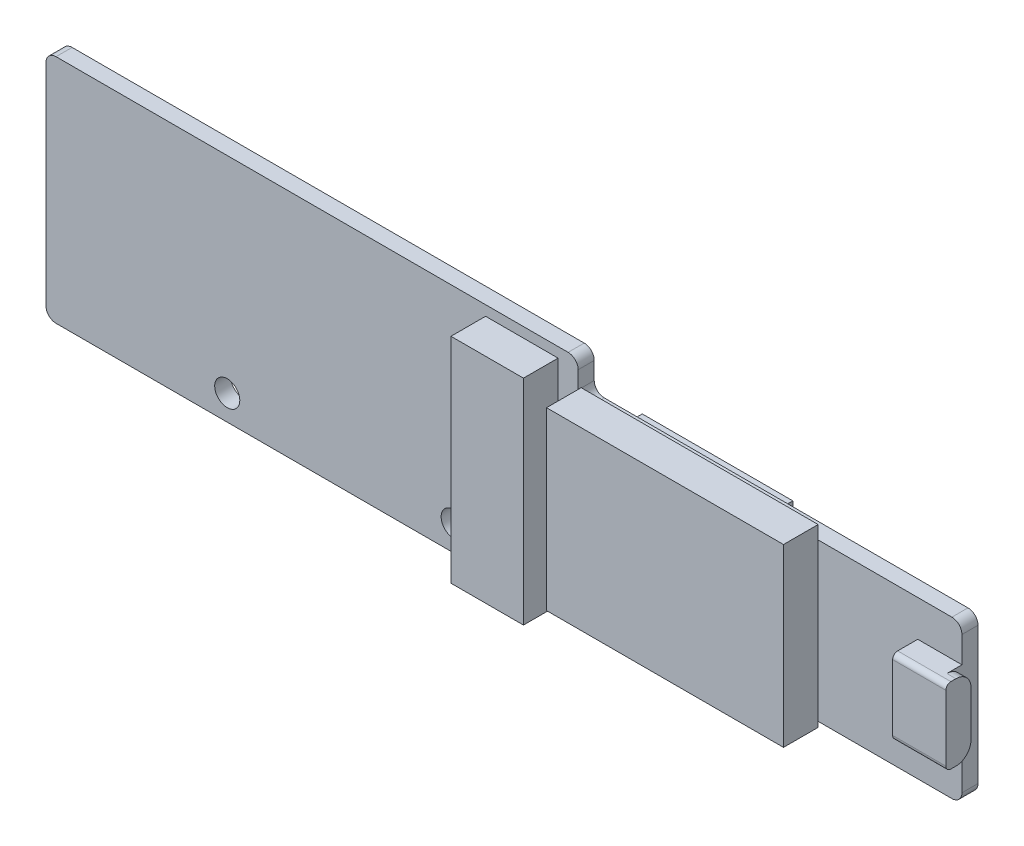
from build123d import *

# Parameters (mm, degrees)
SKETCH1_R           = 1.25
BOSS_EXTRUDE2_DEPTH = 1.6
SKETCH2_W           = 15
SKETCH2_H           = 15.35
BOSS_EXTRUDE3_DEPTH = 0.66
SKETCH3_W           = 5.3
SKETCH3_H           = 7.54
BOSS_EXTRUDE4_DEPTH = 2.5
FILLET1_R           = 0.5
FILLET2_R           = 1.5
SKETCH4_W           = 5.3
SKETCH4_H           = 7.54
BOSS_EXTRUDE5_DEPTH = 2.5
FILLET3_R           = 0.5
FILLET4_R           = 1.5
SKETCH5_W           = 7.22
SKETCH5_H           = 21.3
SKETCH5_W_2         = 23.6
SKETCH5_H_2         = 17.5
BOSS_EXTRUDE6_DEPTH = 3.45
FILLET5_R           = 1


with BuildPart() as part:
    # Sketch1 → Boss-Extrude2 (new body)
    with BuildSketch(Plane.XY):
        Polygon((0, 0), (53, 0), (53, 3.62), (91.22, 3.62), (91.22, 19.27), (53, 19.27), (53, 23), (0, 23), align=None)
        with Locations((40.6, 2.5)):
            Circle(SKETCH1_R, mode=Mode.SUBTRACT)
        with Locations((18.05, 2.5)):
            Circle(SKETCH1_R, mode=Mode.SUBTRACT)
    extrude(amount=BOSS_EXTRUDE2_DEPTH)

    # Sketch2 → Boss-Extrude3 (add)
    with BuildSketch(Plane(origin=(0, 0, 0), x_dir=(-1, 0, 0), z_dir=(0, 0, -1))):
        with Locations((-64.62, 11.445)):
            Rectangle(SKETCH2_W, SKETCH2_H)
    extrude(amount=BOSS_EXTRUDE3_DEPTH)

    # Sketch3 → Boss-Extrude4 (add)
    with BuildSketch(Plane.XY.offset(1.6)):
        with Locations((89.47, 11.89)):
            Rectangle(SKETCH3_W, SKETCH3_H)
    extrude(amount=BOSS_EXTRUDE4_DEPTH)

    # Fillet1
    fillet1_edges = [part.edges().sort_by_distance(p)[0] for p in [
        (89.47, 15.66, 4.1),
        (89.47, 8.12, 4.1),
    ]]
    fillet(fillet1_edges, radius=FILLET1_R)

    # Fillet2
    fillet2_edges = [part.edges().sort_by_distance(p)[0] for p in [
        (91.67, 15.66, 1.6),
        (91.67, 8.12, 1.6),
    ]]
    fillet(fillet2_edges, radius=FILLET2_R)

    # Sketch4 → Boss-Extrude5 (add)
    with BuildSketch(Plane(origin=(0, 0, 0), x_dir=(-1, 0, 0), z_dir=(0, 0, -1))):
        with Locations((-1.75, 11.47)):
            Rectangle(SKETCH4_W, SKETCH4_H)
    extrude(amount=BOSS_EXTRUDE5_DEPTH)

    # Fillet3
    fillet3_edges = [part.edges().sort_by_distance(p)[0] for p in [
        (1.75, 15.24, -2.5),
        (1.75, 7.7, -2.5),
    ]]
    fillet(fillet3_edges, radius=FILLET3_R)

    # Fillet4
    fillet4_edges = [part.edges().sort_by_distance(p)[0] for p in [
        (-0.45, 15.24, 0),
        (-0.45, 7.7, 0),
    ]]
    fillet(fillet4_edges, radius=FILLET4_R)

    # Sketch5 → Boss-Extrude6 (add)
    with BuildSketch(Plane.XY.offset(1.6)):
        with Locations((47.39, 11.35)):
            Rectangle(SKETCH5_W, SKETCH5_H)
        with Locations((65.1, 11.85)):
            Rectangle(SKETCH5_W_2, SKETCH5_H_2)
    extrude(amount=BOSS_EXTRUDE6_DEPTH)

    # Fillet5
    # the kernel refuses this fillet: 1 mm, written as the material it adds along each edge
    with BuildSketch(Plane(origin=(53, 19.27, 0), x_dir=(0, 1, 0), z_dir=(0, 0, 1)), Plane(origin=(53, 3.62, 0), x_dir=(1, 0, 0), z_dir=(0, 0, 1))) as fillet5_piece_1:
        with BuildLine():
            CenterArc((FILLET5_R, -FILLET5_R), FILLET5_R, 90, 90)
            Line((0, -FILLET5_R), (0, 0))
            Line((0, 0), (FILLET5_R, 0))
        make_face()
    extrude(amount=1.6)
    # the kernel refuses this fillet: 1 mm, written as the material it takes off along each edge
    with BuildSketch(Plane(origin=(0, 23, -2.5), x_dir=(1, 0, 0), z_dir=(0, 0, 1))) as fillet5_2_piece_1:
        with BuildLine():
            CenterArc((FILLET5_R, -FILLET5_R), FILLET5_R, 90, 90)
            Line((0, -FILLET5_R), (0, 0))
            Line((0, 0), (FILLET5_R, 0))
        make_face()
    extrude(amount=6.6, mode=Mode.SUBTRACT)
    with BuildSketch(Plane(origin=(53, 23, -2.5), x_dir=(-1, 0, 0), z_dir=(0, 0, 1)), Plane(origin=(91.22, 19.27, -2.5), x_dir=(-1, 0, 0), z_dir=(0, 0, 1)), Plane(origin=(91.22, 3.62, -2.5), x_dir=(0, 1, 0), z_dir=(0, 0, 1)), Plane(origin=(53, 0, -2.5), x_dir=(0, 1, 0), z_dir=(0, 0, 1)), Plane(origin=(0, 0, -2.5), x_dir=(1, 0, 0), z_dir=(0, 0, 1))) as fillet5_2_piece_2:
        with BuildLine():
            CenterArc((FILLET5_R, FILLET5_R), FILLET5_R, 180, 90)
            Line((0, FILLET5_R), (0, 0))
            Line((0, 0), (FILLET5_R, 0))
        make_face()
    extrude(amount=6.6, mode=Mode.SUBTRACT)


solid = part.part
